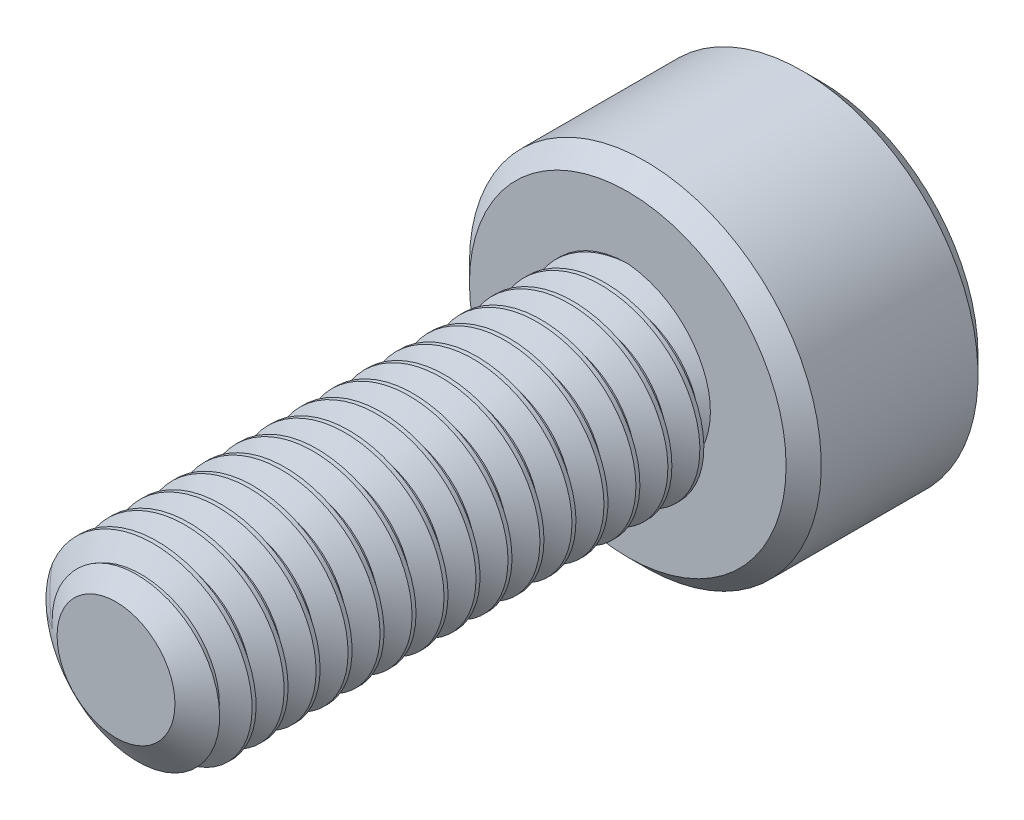
from build123d import *

# Parameters (mm, degrees)
SKETCH1_R          = 1.5
EXTRUDE1_DEPTH     = 8
CUT_SWEEP1_PITCH   = 0.5
SKETCH6_R          = 2.75
EXTRUDE2_DEPTH     = 3
CUT_EXTRUDE1_DEPTH = 1.875
CHAMFER1_SIZE      = 0.275


with BuildPart() as part:
    # Sketch1 → Extrude1 (new body)
    with BuildSketch(Plane.XY):
        Circle(SKETCH1_R)
    extrude(amount=-EXTRUDE1_DEPTH)

    # Cut-Sweep1: the profile of Sketch3 profile screwed along a right-hand helix of 17 turns, 6 arcs to a turn; built about Z, then put on its axis
    cut_sweep1_z = Axis((0, 0, 0), (0, 0, 1))
    cut_sweep1_corners = [(1.5003, 0, -0.437673205), (1.175240474, 0, -0.25), (1.175240474, 0, -0.1875), (1.5003, 0, 0.000173205)]
    with BuildLine(mode=Mode.PRIVATE) as cut_sweep1_profile:
        Line(cut_sweep1_corners[0], cut_sweep1_corners[1])
        Line(cut_sweep1_corners[1], cut_sweep1_corners[2])
        Line(cut_sweep1_corners[2], cut_sweep1_corners[3])
        Line(cut_sweep1_corners[3], cut_sweep1_corners[0])
    cut_sweep1_cap = Face(cut_sweep1_profile.wire())
    cut_sweep1_turn_angles = [0, 30, 60, 90, 120, 150, 180, 210, 240, 270, 300, 330, 360]
    cut_sweep1_turn_weights = [1, 0.8660254037844387, 1, 0.8660254037844387, 1, 0.8660254037844387, 1, 0.8660254037844387, 1, 0.8660254037844387, 1, 0.8660254037844387, 1]
    cut_sweep1_turn_rails = [Edge.make_bspline([Vector(p[0], p[1], 0).rotate(cut_sweep1_z, cut_sweep1_turn_angles[k]) / cut_sweep1_turn_weights[k] + Vector(0, 0, p[2] + CUT_SWEEP1_PITCH * cut_sweep1_turn_angles[k] / 360) for k in range(13)], [0, 0, 0, 1, 1, 2, 2, 3, 3, 4, 4, 5, 5, 6, 6, 6], 2, cut_sweep1_turn_weights) for p in cut_sweep1_corners]
    cut_sweep1_turn_sides = [Face.make_surface_from_curves(cut_sweep1_turn_rails[p[0]], cut_sweep1_turn_rails[p[1]]) for p in [(0, 1), (1, 2), (2, 3), (3, 0)]]
    cut_sweep1 = Plane(origin=(0, 0, 0), x_dir=(0, 1, 0), z_dir=(0, 0, -1)) * Solid(Shell([*[p.moved(Location((0, 0, CUT_SWEEP1_PITCH * i))) for i in range(17) for p in cut_sweep1_turn_sides], cut_sweep1_cap, cut_sweep1_cap.rotate(cut_sweep1_z, 6120).moved(Location((0, 0, CUT_SWEEP1_PITCH * 6120 / 360)))]))
    add(cut_sweep1, mode=Mode.SUBTRACT)

    # Sketch4 → Cut-Revolve1 (revolve, cut)
    with BuildSketch(Plane(origin=(0, 0, 0), x_dir=(0, 0, -1), z_dir=(1, 0, 0)), mode=Mode.PRIVATE) as cut_revolve1_sk:
        Polygon((0.405251783, 1.5), (0, 0.921240474), (0, 1.5), align=None)
    revolve(cut_revolve1_sk.sketch.rotate(Axis((0, 0, 0), (0, 0, -1)), 263.352109169), axis=Axis((0, 0, 0), (0, 0, -1)), mode=Mode.SUBTRACT)

    # Sketch6 → Extrude2 (add)
    with BuildSketch(Plane(origin=(0, 0, -8), x_dir=(-1, 0, 0), z_dir=(0, 0, -1))):
        Circle(SKETCH6_R)
    extrude(amount=EXTRUDE2_DEPTH)

    # Sketch7 → Cut-Extrude1 (cut)
    with BuildSketch(Plane(origin=(0, 0, -11), x_dir=(-1, 0, 0), z_dir=(0, 0, -1))):
        Polygon((0, 1.443375673), (-1.25, 0.721687836), (-1.25, -0.721687836), (0, -1.443375673), (1.25, -0.721687836), (1.25, 0.721687836), align=None)
    extrude(amount=-CUT_EXTRUDE1_DEPTH, mode=Mode.SUBTRACT)

    # Cut-Extrude2 cone 1 section (through the dimple's axis) → Cut-Extrude2 (revolve, cut)
    with BuildSketch(Plane(origin=(0, 0, -11), x_dir=(0, 1, 0), z_dir=(1, 0, 0))):
        Polygon((0, 0), (1.443375673, 0), (0, 1.443375673), align=None)
    revolve(axis=Axis((0, 0, -11), (0, 0, 1)), mode=Mode.SUBTRACT)

    # Chamfer1
    chamfer1_edges = [part.edges().sort_by_distance(p)[0] for p in [
        (2.75, 0, -8),
        (2.75, 0, -11),
    ]]
    chamfer(chamfer1_edges, length=CHAMFER1_SIZE)


solid = part.part
